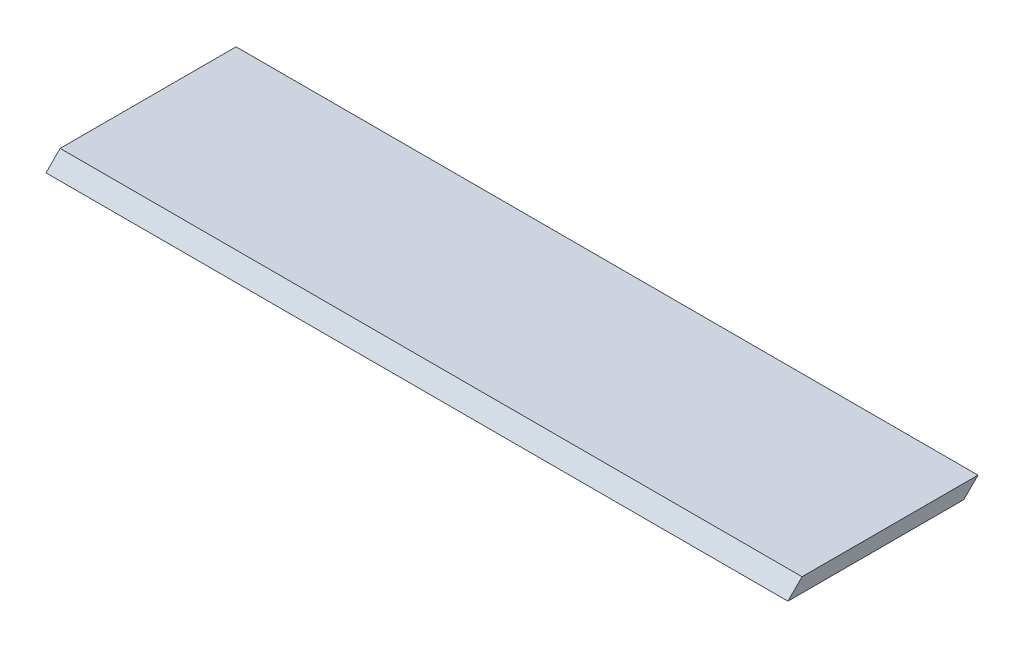
from build123d import *

# Parameters (mm, degrees)
SKETCH2_W           = 105
SKETCH2_H           = 26.9
BOSS_EXTRUDE1_DEPTH = 2
CHAMFER1_SIZE       = 2
CHAMFER2_SIZE       = 2


with BuildPart() as part:
    # Sketch2 → Boss-Extrude1 (new body)
    with BuildSketch(Plane(origin=(0, 0, 0), x_dir=(1, 0, 0), z_dir=(0, 1, 0))):
        with Locations((0, 4.668100445)):
            Rectangle(SKETCH2_W, SKETCH2_H)
    extrude(amount=BOSS_EXTRUDE1_DEPTH)

    # Chamfer1
    chamfer1_edges = [part.edges().sort_by_distance(p)[0] for p in [
        (0, 2, 8.781899555),
    ]]
    chamfer(chamfer1_edges, length=CHAMFER1_SIZE - 0.0001)  # a hair under: the kernel refuses the full size

    # Chamfer2
    chamfer2_edges = [part.edges().sort_by_distance(p)[0] for p in [
        (0, 0, -18.118100445),
    ]]
    chamfer(chamfer2_edges, length=CHAMFER2_SIZE - 0.0001)  # a hair under: the kernel refuses the full size


solid = part.part
